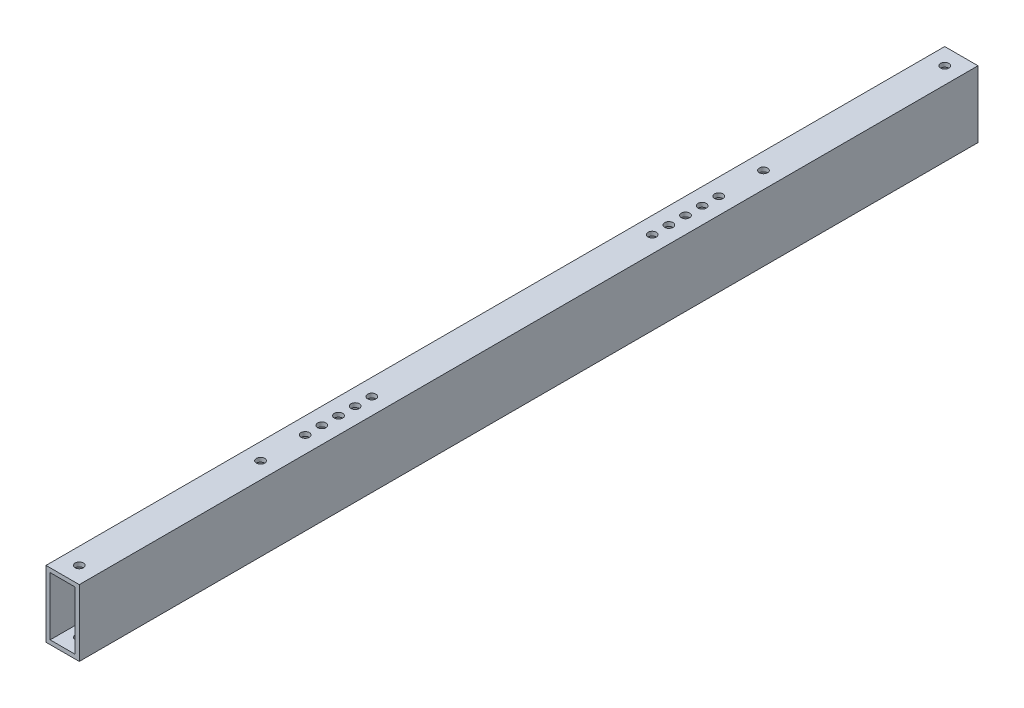
from build123d import *

# Parameters (mm, degrees)
SKETCH1_W           = 25.4
SKETCH1_H           = 50.8
SKETCH1_W_2         = 19.05
SKETCH1_H_2         = 44.45
BOSS_EXTRUDE1_DEPTH = 685.8
SKETCH2_R           = 3.175
CUT_EXTRUDE1_DEPTH  = 688.796168934


with BuildPart() as part:
    # Sketch1 → Boss-Extrude1 (new body)
    with BuildSketch(Plane.XY):
        Rectangle(SKETCH1_W, SKETCH1_H)
        Rectangle(SKETCH1_W_2, SKETCH1_H_2, mode=Mode.SUBTRACT)
    extrude(amount=BOSS_EXTRUDE1_DEPTH)

    # Sketch2 → Cut-Extrude1 (cut, through all)
    with BuildSketch(Plane(origin=(0, 25.4, 0), x_dir=(1, 0, 0), z_dir=(0, 1, 0))):
        with Locations((0, -12.7)):
            Circle(SKETCH2_R)
        with Locations((0, -151.012144)):
            Circle(SKETCH2_R)
        with Locations((0, -534.787856)):
            Circle(SKETCH2_R)
        with Locations((0, -673.1)):
            Circle(SKETCH2_R)
        with Locations((0, -185.1062846)):
            Circle(SKETCH2_R)
        with Locations((0, -197.8062846)):
            Circle(SKETCH2_R)
        with Locations((0, -210.5062846)):
            Circle(SKETCH2_R)
        with Locations((0, -223.2062846)):
            Circle(SKETCH2_R)
        with Locations((0, -235.9062846)):
            Circle(SKETCH2_R)
        with Locations((0, -449.8937154)):
            Circle(SKETCH2_R)
        with Locations((0, -462.5937154)):
            Circle(SKETCH2_R)
        with Locations((0, -475.2937154)):
            Circle(SKETCH2_R)
        with Locations((0, -487.9937154)):
            Circle(SKETCH2_R)
        with Locations((0, -500.6937154)):
            Circle(SKETCH2_R)
    extrude(amount=-CUT_EXTRUDE1_DEPTH, mode=Mode.SUBTRACT)


solid = part.part
